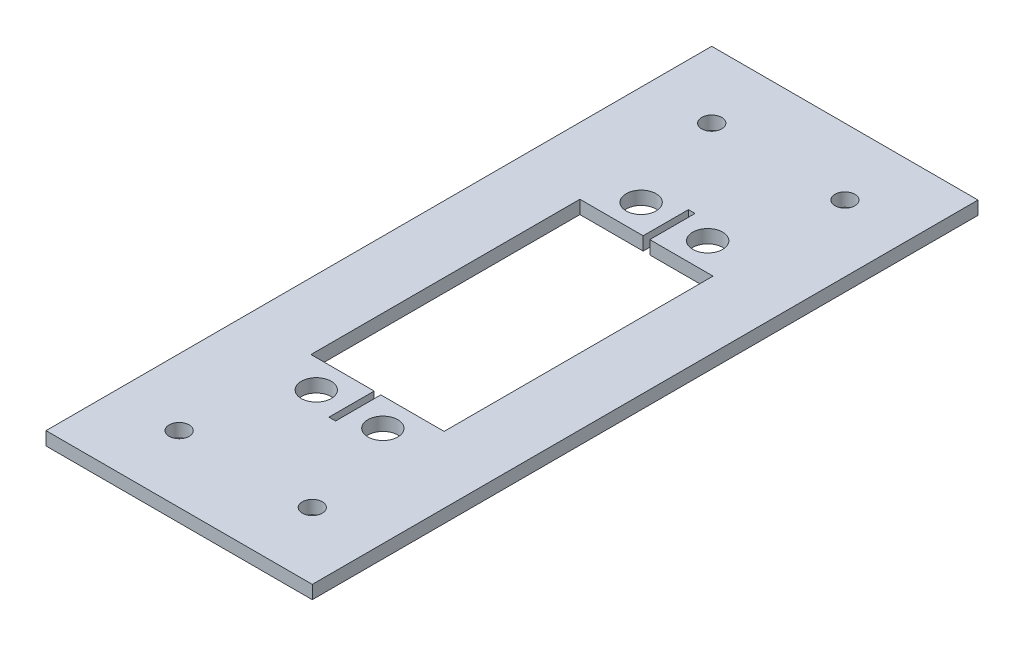
from build123d import *

# Parameters (mm, degrees)
SKETCH1_W           = 40
SKETCH1_H           = 100
SKETCH1_R           = 1.5
SKETCH1_R_2         = 2.25
BOSS_EXTRUDE1_DEPTH = 2


with BuildPart() as part:
    # Sketch1 → Boss-Extrude1 (new body)
    with BuildSketch(Plane(origin=(0, 0, 0), x_dir=(1, 0, 0), z_dir=(0, 1, 0))):
        with Locations((0.735982487, -0.367991244)):
            Rectangle(SKETCH1_W, SKETCH1_H)
        with Locations((-9.264017513, -40.367991244)):
            Circle(SKETCH1_R, mode=Mode.SUBTRACT)
        with Locations((-4.264017513, -24.767991244)):
            Circle(SKETCH1_R_2, mode=Mode.SUBTRACT)
        with Locations((10.735982487, -40.367991244)):
            Circle(SKETCH1_R, mode=Mode.SUBTRACT)
        with Locations((5.735982487, -24.767991244)):
            Circle(SKETCH1_R_2, mode=Mode.SUBTRACT)
        with Locations((-4.264017513, 24.032008756)):
            Circle(SKETCH1_R_2, mode=Mode.SUBTRACT)
        with Locations((-9.264017513, 39.632008756)):
            Circle(SKETCH1_R, mode=Mode.SUBTRACT)
        Polygon((0.235982487, 26.632008756), (0.735982487, 26.632008756), (1.235982487, 26.632008756), (1.235982487, 19.832008756), (10.735982487, 19.832008756), (10.735982487, -20.567991244), (1.235982487, -20.567991244), (1.235982487, -27.367991244), (0.735982487, -27.367991244), (0.235982487, -27.367991244), (0.235982487, -20.567991244), (-9.264017513, -20.567991244), (-9.264017513, 19.832008756), (0.235982487, 19.832008756), align=None, mode=Mode.SUBTRACT)
        with Locations((5.735982487, 24.032008756)):
            Circle(SKETCH1_R_2, mode=Mode.SUBTRACT)
        with Locations((10.735982487, 39.632008756)):
            Circle(SKETCH1_R, mode=Mode.SUBTRACT)
    extrude(amount=BOSS_EXTRUDE1_DEPTH)


solid = part.part
